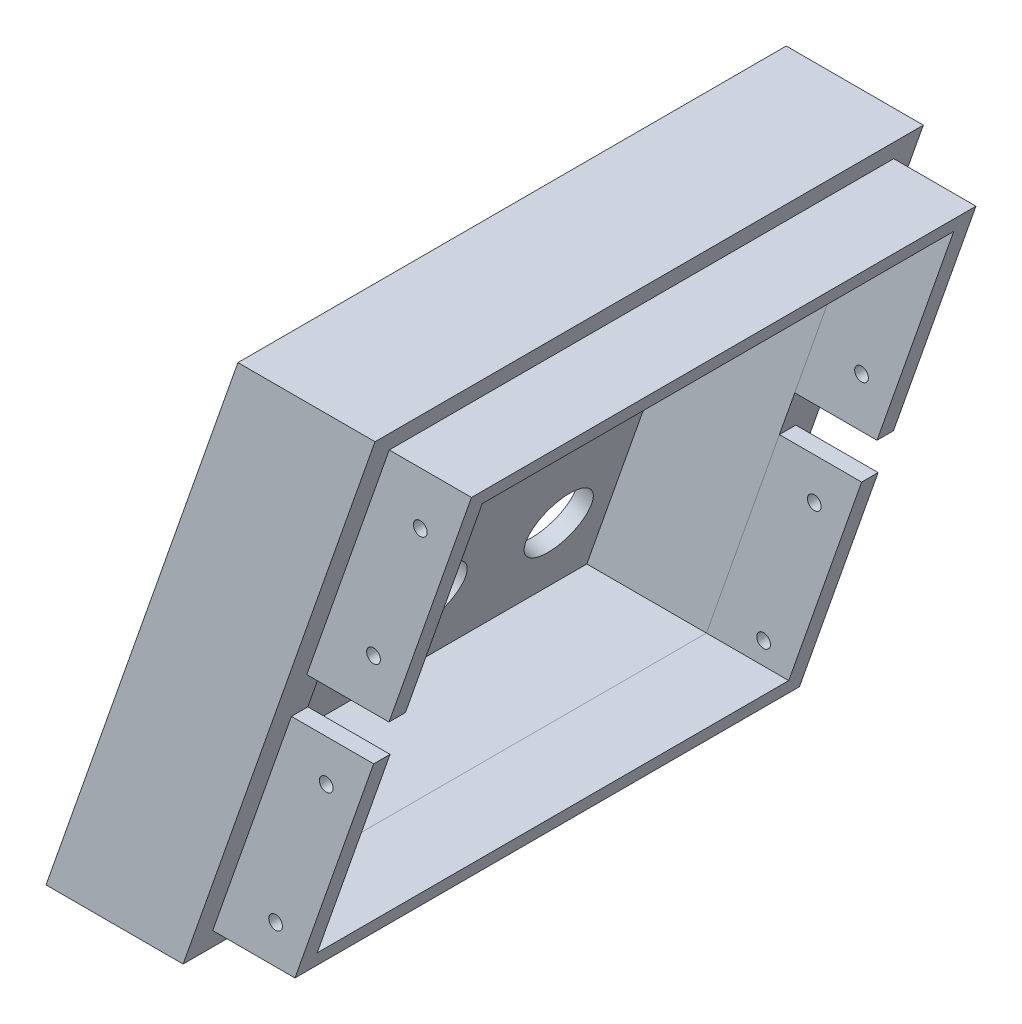
from build123d import *

# Parameters (mm, degrees)
DODANIE_WYCI_GNI_CIE1_DEPTH    = 100
DODANIE_WYCI_GNI_CIE2_START    = -96
DODANIE_WYCI_GNI_CIE2_DEPTH    = 96.000012
SZKIC3_R                       = 1.25
WYTNIJ_WYCI_GNI_CIE2_DEPTH     = 100
WYTNIJ_WYCI_GNI_CIE3_DEPTH     = 4
WYTNIJ_WYCI_GNI_CIE4_START     = 7
WYTNIJ_WYCI_GNI_CIE4_OUTLINE_R = 1.25
WYTNIJ_WYCI_GNI_CIE4_DEPTH     = 86.000012
SZKIC9_W                       = 59
SZKIC9_H                       = 42
SZKIC9_W_2                     = 12
SZKIC9_H_2                     = 18.5
WYTNIJ_WYCI_GNI_CIE5_DEPTH     = 3
SZKIC10_R                      = 3
SZKIC10_R_2                    = 1.5
DODANIE_WYCI_GNI_CIE3_DEPTH    = 4
SZKIC13_R                      = 6
WYTNIJ_WYCI_GNI_CIE6_DEPTH     = 4
ZAOKR_GLENIE1_R                = 1.5


# Read off the part's stored shape, not the designer's step: Dodanie-wyciągnięcie2, Wytnij-wyciągnięcie4
with BuildPart() as part:
    # Szkic1 → Dodanie-wyciągnięcie1 (new body)
    with BuildSketch(Plane.XY):
        Polygon((0, 0), (25, 0), (60, 100), (35, 100), align=None)
    extrude(amount=DODANIE_WYCI_GNI_CIE1_DEPTH)


with BuildPart() as body_2:
    # Dodanie-wyciągnięcie2 outline → Dodanie-wyciągnięcie2 (new body)
    with BuildSketch(Plane.XY.offset(100).offset(DODANIE_WYCI_GNI_CIE2_START)):
        Polygon((73.6, 96), (58.6, 96), (43.55, 53), (58.55, 53), align=None)
        Polygon((55.75, 45), (40.75, 45), (26.4, 4), (41.4, 4), align=None)
    extrude(amount=DODANIE_WYCI_GNI_CIE2_DEPTH)

    # Szkic3 → Wytnij-wyciągnięcie2 (cut)
    with BuildSketch(Plane.XY.offset(100.000012)):
        with Locations((64.251332646, 86.416411722)):
            Circle(SZKIC3_R)
        with Locations((55.727425581, 62.062391537)):
            Circle(SZKIC3_R)
        with Locations((47.110009053, 37.441201457)):
            Circle(SZKIC3_R)
        with Locations((37.867118116, 11.032941637)):
            Circle(SZKIC3_R)
    extrude(amount=-WYTNIJ_WYCI_GNI_CIE2_DEPTH, mode=Mode.SUBTRACT)

    # Szkic4 → Wytnij-wyciągnięcie3 (cut)
    with BuildSketch(Plane.XY.offset(100.000012)):
        Polygon((26.4, 4), (58.6, 96), (73.6, 96), (41.4, 4), align=None)
    extrude(amount=-WYTNIJ_WYCI_GNI_CIE3_DEPTH, mode=Mode.SUBTRACT)


with BuildPart() as wytnij_wyci_gni_cie4_tool:
    # Wytnij-wyciągnięcie4 outline → Wytnij-wyciągnięcie4 (new body)
    with BuildSketch(Plane.XY.offset(WYTNIJ_WYCI_GNI_CIE4_START)):
        Polygon((40.75, 45), (43.55, 53), (58.55, 53), (72.55, 93), (35.728443015, 93), (5.628443015, 7), (42.45, 7), (55.75, 45), align=None)
        with Locations((64.251332646, 86.416411722)):
            Circle(WYTNIJ_WYCI_GNI_CIE4_OUTLINE_R, mode=Mode.SUBTRACT)
        with Locations((55.727425581, 62.062391537)):
            Circle(WYTNIJ_WYCI_GNI_CIE4_OUTLINE_R, mode=Mode.SUBTRACT)
        with Locations((47.110009053, 37.441201457)):
            Circle(WYTNIJ_WYCI_GNI_CIE4_OUTLINE_R, mode=Mode.SUBTRACT)
        with Locations((37.867118116, 11.032941637)):
            Circle(WYTNIJ_WYCI_GNI_CIE4_OUTLINE_R, mode=Mode.SUBTRACT)
    extrude(amount=WYTNIJ_WYCI_GNI_CIE4_DEPTH)


with BuildPart() as part_1:
    add(part.part)

    # Wytnij-wyciągnięcie4: cut by wytnij_wyci_gni_cie4_tool
    add(wytnij_wyci_gni_cie4_tool.part, mode=Mode.SUBTRACT)

    # Szkic9 → Wytnij-wyciągnięcie5 (cut)
    with BuildSketch(Plane(origin=(0, 0, 0), x_dir=(0, 0, 1), z_dir=(-0.9438583563660174, 0.33035042472810605, 0))):
        with Locations((47.5, 69.948100502)):
            Rectangle(SZKIC9_W, SZKIC9_H)
        with Locations((84, 24.475)):
            Rectangle(SZKIC9_W_2, SZKIC9_H_2)
    extrude(amount=-WYTNIJ_WYCI_GNI_CIE5_DEPTH, mode=Mode.SUBTRACT)

    # Szkic10 → Dodanie-wyciągnięcie3 (add)
    # profile 1 of 4: a face of its own
    with BuildSketch(Plane(origin=(2.831575069, -0.991051274, 0), x_dir=(0, 0, -1), z_dir=(0.9438583563660174, -0.33035042472810605, 0))):
        with Locations(Location((-89, 88.948100502, 0), (0, 0, 270))):
            Circle(SZKIC10_R)
        with Locations(Location((-89, 88.948100502, 0), (0, 0, 90))):
            Circle(SZKIC10_R_2, mode=Mode.SUBTRACT)
    # profile 2 of 4: a face of its own
    with BuildSketch(Plane(origin=(2.831575069, -0.991051274, 0), x_dir=(0, 0, -1), z_dir=(0.9438583563660174, -0.33035042472810605, 0))):
        with Locations(Location((-89, 50.948100502, 0), (0, 0, 270))):
            Circle(SZKIC10_R)
        with Locations(Location((-89, 50.948100502, 0), (0, 0, 90))):
            Circle(SZKIC10_R_2, mode=Mode.SUBTRACT)
    # profile 3 of 4: a face of its own
    with BuildSketch(Plane(origin=(2.831575069, -0.991051274, 0), x_dir=(0, 0, -1), z_dir=(0.9438583563660174, -0.33035042472810605, 0))):
        with Locations(Location((-11, 50.948100502, 0), (0, 0, 270))):
            Circle(SZKIC10_R)
        with Locations(Location((-11, 50.948100502, 0), (0, 0, 90))):
            Circle(SZKIC10_R_2, mode=Mode.SUBTRACT)
    # profile 4 of 4: a face of its own
    with BuildSketch(Plane(origin=(2.831575069, -0.991051274, 0), x_dir=(0, 0, -1), z_dir=(0.9438583563660174, -0.33035042472810605, 0))):
        with Locations(Location((-11, 88.948100502, 0), (0, 0, 270))):
            Circle(SZKIC10_R)
        with Locations(Location((-11, 88.948100502, 0), (0, 0, 90))):
            Circle(SZKIC10_R_2, mode=Mode.SUBTRACT)
    extrude(amount=DODANIE_WYCI_GNI_CIE3_DEPTH)

    # Szkic13 → Wytnij-wyciągnięcie6 (cut)
    with BuildSketch(Plane(origin=(0, 0, 0), x_dir=(0, 0, 1), z_dir=(-0.9438583563660174, 0.33035042472810605, 0))):
        with Locations(Location((17, 23.225, 0), (0, 0, 270))):
            Circle(SZKIC13_R)
        with Locations(Location((40, 23.225, 0), (0, 0, 270))):
            Circle(SZKIC13_R)
        with Locations(Location((63, 23.225, 0), (0, 0, 270))):
            Circle(SZKIC13_R)
    extrude(amount=-WYTNIJ_WYCI_GNI_CIE6_DEPTH, mode=Mode.SUBTRACT)

    # Zaokrąglenie1
    zaokr_glenie1_edges = [part_1.edges().sort_by_distance(p)[0] for p in [
        (23.10738471, 66.021099171, 18),
        (16.17002579, 46.200073687, 47.5),
        (23.10738471, 66.021099171, 77),
        (30.044743629, 85.842124655, 47.5),
    ]]
    fillet(zaokr_glenie1_edges, radius=ZAOKR_GLENIE1_R)


with BuildPart() as body_2_1:
    add(body_2.part)

    # Wytnij-wyciągnięcie4: cut by wytnij_wyci_gni_cie4_tool
    add(wytnij_wyci_gni_cie4_tool.part, mode=Mode.SUBTRACT)


solid = Compound([part_1.part, body_2_1.part])
